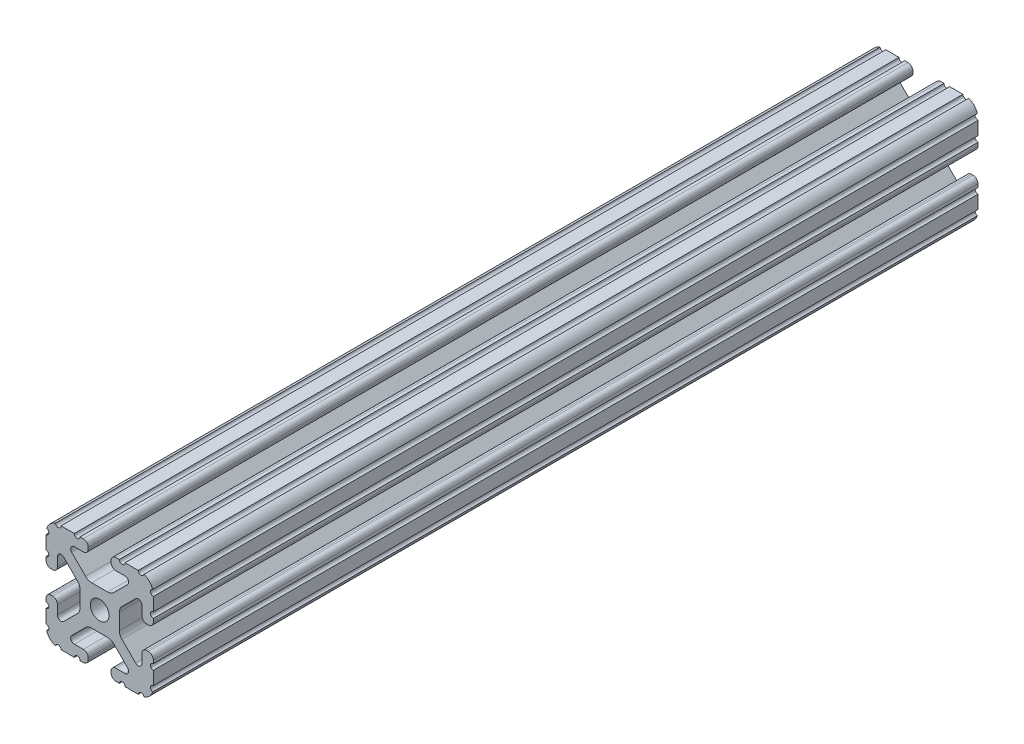
from build123d import *

# Parameters (mm, degrees)
BOSS_EXTRUDE1_DEPTH     = 146.414999929
CUT_EXTRUDE1_DEPTH      = 149.872956591
CUT_EXTRUDE1_DEPTH_BACK = 149.872956591
SKETCH5_R               = 1.016


with BuildPart() as part:
    # Sketch4 → Boss-Extrude1 (new, symmetric)
    with BuildSketch(Plane.XY):
        with BuildLine():
            Line((5.7912, -19.05), (14.3002, -19.05))
            ThreePointArc((14.3002, -19.05), (17.658815789, -17.658815789), (19.05, -14.3002))
            Line((19.05, -14.3002), (19.05, -5.7912))
            ThreePointArc((19.05, -5.7912), (18.544114832, -4.569885168), (17.3228, -4.064))
            Line((17.3228, -4.064), (16.7132, -4.064))
            ThreePointArc((16.7132, -4.064), (15.491885168, -4.569885168), (14.986, -5.7912))
            Line((14.986, -5.7912), (14.986, -8.996305235))
            ThreePointArc((14.986, -8.996305235), (14.189232738, -10.188751711), (12.782646215, -9.908964256))
            Line((12.782646215, -9.908964256), (7.888897763, -5.015215804))
            ThreePointArc((7.888897763, -5.015215804), (7.219915375, -4.014012907), (6.985, -2.833013566))
            Line((6.985, -2.833013566), (6.985, 0))
            Line((6.985, 0), (3.3274, 0))
            ThreePointArc((3.3274, 0), (2.352827104, -2.352827104), (0, -3.3274))
            Line((0, -3.3274), (0, -6.985))
            Line((0, -6.985), (2.833013566, -6.985))
            ThreePointArc((2.833013566, -6.985), (4.014012907, -7.219915375), (5.015215804, -7.888897763))
            Line((5.015215804, -7.888897763), (9.908964256, -12.782646215))
            ThreePointArc((9.908964256, -12.782646215), (10.188751711, -14.189232738), (8.996305235, -14.986))
            Line((8.996305235, -14.986), (5.7912, -14.986))
            ThreePointArc((5.7912, -14.986), (4.569885168, -15.491885168), (4.064, -16.7132))
            Line((4.064, -16.7132), (4.064, -17.3228))
            ThreePointArc((4.064, -17.3228), (4.569885168, -18.544114832), (5.7912, -19.05))
        make_face()
    extrude(amount=BOSS_EXTRUDE1_DEPTH, both=True)

    # Sketch5 → Cut-Extrude1 (cut, two sides: drawn at the far end of the back side and taken through both)
    with BuildSketch(Plane.XY.offset(-CUT_EXTRUDE1_DEPTH_BACK)):
        with Locations((14.739477062, -19.05)):
            Circle(SKETCH5_R)
        with Locations((7.980305235, -19.05)):
            Circle(SKETCH5_R)
        with Locations((19.05, -14.739477062)):
            Circle(SKETCH5_R)
        with Locations((19.05, -7.980305235)):
            Circle(SKETCH5_R)
    extrude(amount=CUT_EXTRUDE1_DEPTH + CUT_EXTRUDE1_DEPTH_BACK, mode=Mode.SUBTRACT)

    # Mirror1: part across plane


with BuildPart() as part_1:
    add(part.part)
    add(part.part.mirror(Plane(origin=(0, 0, 0), x_dir=(0, 0, 1), z_dir=(1, 0, 0))))

    # Mirror2: part across plane


with BuildPart() as part_2:
    add(part_1.part)
    add(part_1.part.mirror(Plane.ZX))


solid = part_2.part
